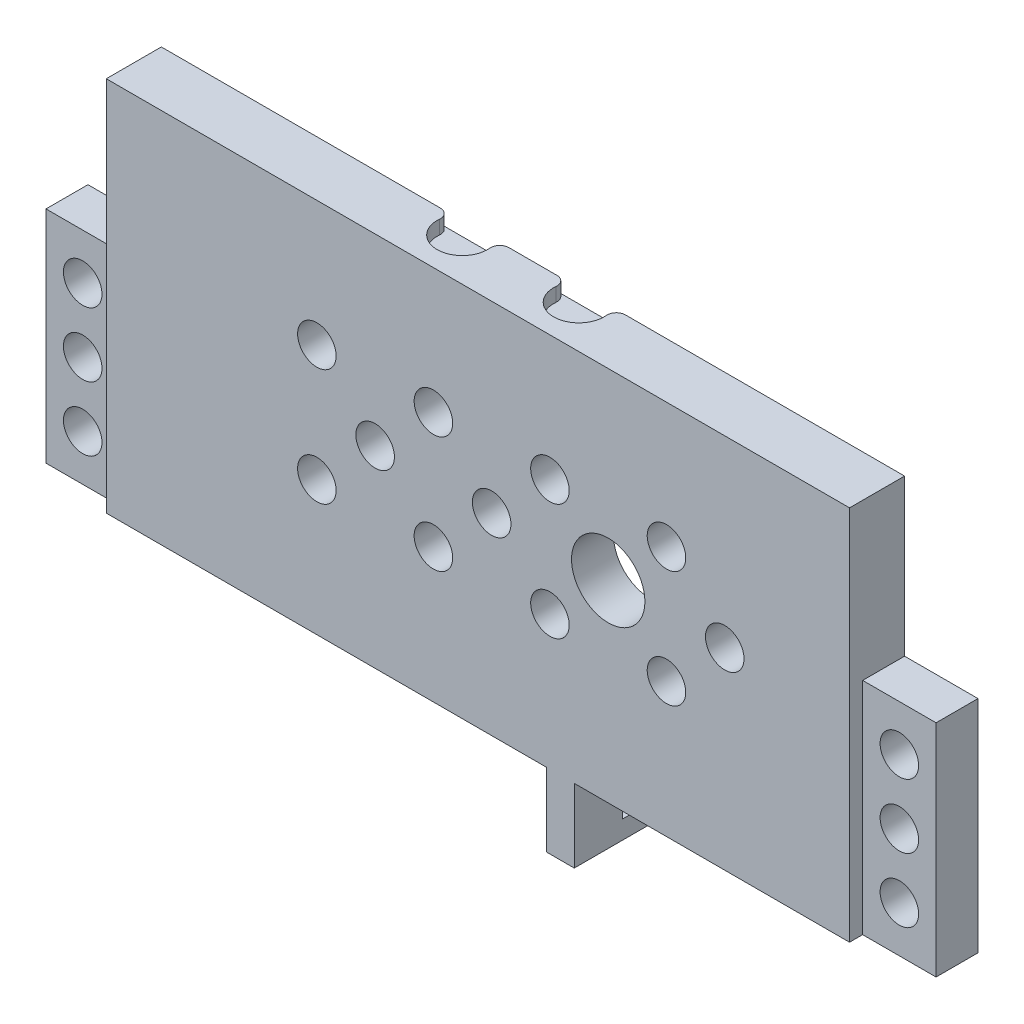
from build123d import *

# Parameters (mm, degrees)
SKETCH1_W           = 81
SKETCH1_H           = 41
BOSS_EXTRUDE1_DEPTH = 6
SKETCH5_W           = 75
SKETCH5_H           = 35
CUT_EXTRUDE1_DEPTH  = 1.43
SKETCH8_R           = 2.1
SKETCH8_R_2         = 4
CUT_EXTRUDE2_DEPTH  = 46.787552894
CUT_EXTRUDE3_DEPTH  = 1.5
FILLET1_R           = 1
SKETCH10_W          = 4.57
SKETCH10_H          = 24
BOSS_EXTRUDE2_DEPTH = 8
SKETCH12_W          = 4.57
SKETCH12_H          = 24
BOSS_EXTRUDE3_DEPTH = 8
SKETCH13_R          = 2.1
CUT_EXTRUDE4_DEPTH  = 53.852482439
SKETCH14_W          = 3
SKETCH14_H          = 21
BOSS_EXTRUDE4_DEPTH = 8
SKETCH15_W          = 10.5
SKETCH15_H          = 4
CUT_EXTRUDE5_DEPTH  = 68.217929156


with BuildPart() as part:
    # Sketch1 → Boss-Extrude1 (new body)
    with BuildSketch(Plane.XY):
        Rectangle(SKETCH1_W, SKETCH1_H)
    extrude(amount=BOSS_EXTRUDE1_DEPTH)

    # Sketch5 → Cut-Extrude1 (cut)
    with BuildSketch(Plane(origin=(0, 0, 0), x_dir=(-1, 0, 0), z_dir=(0, 0, -1))):
        Rectangle(SKETCH5_W, SKETCH5_H)
    extrude(amount=-CUT_EXTRUDE1_DEPTH, mode=Mode.SUBTRACT)

    # Sketch8 → Cut-Extrude2 (cut, through all)
    with BuildSketch(Plane.XY.offset(6)):
        with Locations((26.9, 0.5)):
            Circle(SKETCH8_R)
        with Locations((20.55, 6.849637785)):
            Circle(SKETCH8_R)
        with Locations((7.85, 6.849637785)):
            Circle(SKETCH8_R)
        with Locations((7.85, -5.849637785)):
            Circle(SKETCH8_R)
        with Locations((20.55, -5.849637785)):
            Circle(SKETCH8_R)
        with Locations((1.5, 0.5)):
            Circle(SKETCH8_R)
        with Locations((-4.85, 6.849637785)):
            Circle(SKETCH8_R)
        with Locations((-4.85, -5.849637785)):
            Circle(SKETCH8_R)
        with Locations((-11.2, 0.5)):
            Circle(SKETCH8_R)
        with Locations((-17.55, 6.849637785)):
            Circle(SKETCH8_R)
        with Locations((-17.55, -5.849637785)):
            Circle(SKETCH8_R)
        with Locations((14.2, 0.5)):
            Circle(SKETCH8_R_2)
    extrude(amount=-CUT_EXTRUDE2_DEPTH, mode=Mode.SUBTRACT)

    # Sketch9 → Cut-Extrude3 (cut)
    with BuildSketch(Plane(origin=(0, 20.5, 0), x_dir=(1, 0, 0), z_dir=(0, 1, 0))):
        with BuildLine():
            Line((6.35, 0), (3.95417029, 0))
            ThreePointArc((3.95417029, 0), (6.35, -4.1), (8.74582971, 0))
            Line((8.74582971, 0), (6.35, 0))
        make_face()
        with BuildLine():
            ThreePointArc((-8.74582971, 0), (-6.35, -4.1), (-3.95417029, 0))
            Line((-3.95417029, 0), (-6.35, 0))
            Line((-6.35, 0), (-8.74582971, 0))
        make_face()
    extrude(amount=-CUT_EXTRUDE3_DEPTH, mode=Mode.SUBTRACT)

    # Fillet1
    fillet1_edges = [part.edges().sort_by_distance(p)[0] for p in [
        (3.95417029, 19.75, 0),
        (8.74582971, 19.75, 0),
        (-3.95417029, 19.75, 0),
        (-8.74582971, 19.75, 0),
    ]]
    fillet(fillet1_edges, radius=FILLET1_R)

    # Sketch10 → Boss-Extrude2 (add)
    with BuildSketch(Plane.ZY.offset(40.5)):
        with Locations((2.285, -8.5)):
            Rectangle(SKETCH10_W, SKETCH10_H)
    extrude(amount=BOSS_EXTRUDE2_DEPTH)

    # Sketch12 → Boss-Extrude3 (add)
    with BuildSketch(Plane(origin=(40.5, 0, 0), x_dir=(0, 0, -1), z_dir=(1, 0, 0))):
        with Locations((-2.285, -8.5)):
            Rectangle(SKETCH12_W, SKETCH12_H)
    extrude(amount=BOSS_EXTRUDE3_DEPTH)

    # Sketch13 → Cut-Extrude4 (cut, through all)
    with BuildSketch(Plane.XY.offset(4.57)):
        with Locations((-44.5, -8.5)):
            Circle(SKETCH13_R)
        with Locations((-44.5, -1.5)):
            Circle(SKETCH13_R)
        with Locations((-44.5, -15.5)):
            Circle(SKETCH13_R)
        with Locations((44.5, -8.5)):
            Circle(SKETCH13_R)
        with Locations((44.5, -1.5)):
            Circle(SKETCH13_R)
        with Locations((44.5, -15.5)):
            Circle(SKETCH13_R)
    extrude(amount=-CUT_EXTRUDE4_DEPTH, mode=Mode.SUBTRACT)

    # Sketch14 → Boss-Extrude4 (add)
    with BuildSketch(Plane.XZ.offset(20.5)):
        with Locations((9, -4.5)):
            Rectangle(SKETCH14_W, SKETCH14_H)
    extrude(amount=BOSS_EXTRUDE4_DEPTH)

    # Sketch15 → Cut-Extrude5 (cut, through all)
    with BuildSketch(Plane(origin=(10.5, 0, 0), x_dir=(0, 0, -1), z_dir=(1, 0, 0))):
        with Locations((4.5, -24.5)):
            Rectangle(SKETCH15_W, SKETCH15_H)
    extrude(amount=-CUT_EXTRUDE5_DEPTH, mode=Mode.SUBTRACT)


solid = part.part
